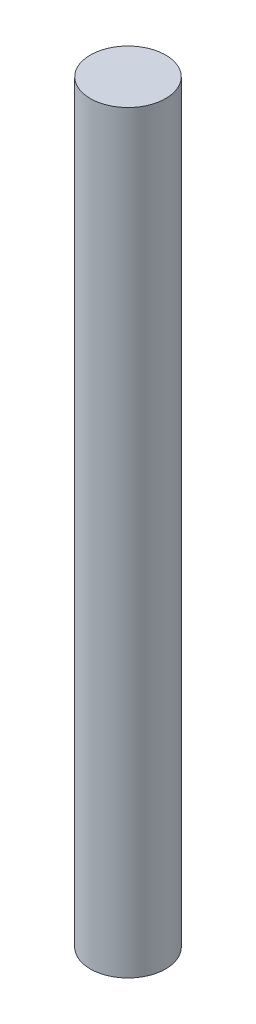
from build123d import *

# Parameters (mm, degrees)
SKIZZE1_R                       = 15
AUFSATZ_LINEAR_AUSTRAGEN1_DEPTH = 300


with BuildPart() as part:
    # Skizze1 → Aufsatz-Linear austragen1 (new body)
    with BuildSketch(Plane(origin=(0, 0, 0), x_dir=(1, 0, 0), z_dir=(0, 1, 0))):
        Circle(SKIZZE1_R)
    extrude(amount=AUFSATZ_LINEAR_AUSTRAGEN1_DEPTH)


solid = part.part
